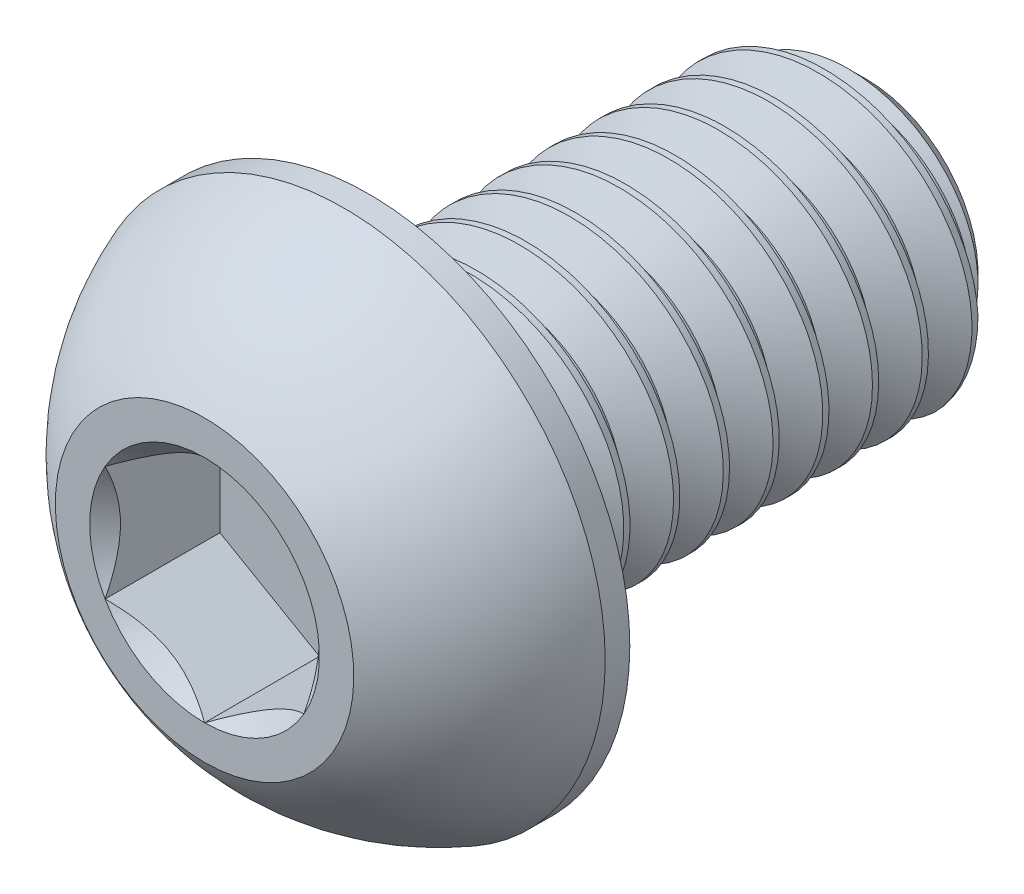
from build123d import *

# Parameters (mm, degrees)
SKETCH1_W              = 10
SKETCH1_H              = 3
CUT_EXTRUDE2_DEPTH     = 2.31
SPLIT1_SURFACE_1_BACK  = 20.935
SPLIT1_SURFACE_1_DEPTH = 41.87
SPLIT1_SURFACE_2_BACK  = 20.935
SPLIT1_SURFACE_2_DEPTH = 41.87
CHAMFER1_SIZE          = 0.75
CUT_SWEEP1_PITCH       = 1
CUT_SWEEP1_TO          = 10


with BuildPart() as part:
    # Sketch1 → Revolve1 (revolve)
    with BuildSketch(Plane(origin=(0, 0, 0), x_dir=(0, 0, -1), z_dir=(1, 0, 0))):
        with Locations((8.3, 1.5)):
            Rectangle(SKETCH1_W, SKETCH1_H)
    revolve(axis=Axis((0, 0, -13.3), (0, 0, 1)))

    # Sketch7 → Revolve2 (revolve)
    with BuildSketch(Plane(origin=(0, 0, 0), x_dir=(0, 0, -1), z_dir=(1, 0, 0)), mode=Mode.PRIVATE) as revolve2_sk:
        with BuildLine():
            Line((2.805, 5.25), (3.3, 5.25))
            Line((3.3, 5.25), (3.3, 0))
            Line((3.3, 0), (0, 0))
            Line((0, 0), (0, 3))
            ThreePointArc((0, 3), (1.216479019, 4.356906156), (2.805, 5.25))
        make_face()
    revolve(revolve2_sk.sketch.rotate(Axis((0, 0, 0), (0, 0, -1)), 180), axis=Axis((0, 0, 0), (0, 0, -1)))

    # Sketch5 → Cut-Extrude2 (cut)
    with BuildSketch(Plane.XY):
        Polygon((2, -1.154700538), (2, 1.154700538), (0, 2.309401077), (-2, 1.154700538), (-2, -1.154700538), (0, -2.309401077), align=None)
    extrude(amount=-CUT_EXTRUDE2_DEPTH, mode=Mode.SUBTRACT)

    # Cut-Extrude3 cone 1 section (through the dimple's axis) → Cut-Extrude3 (revolve, cut)
    with BuildSketch(Plane(origin=(0, 0, 0), x_dir=(0, -1, 0), z_dir=(1, 0, 0))):
        Polygon((0, 0), (2.309401077, 0), (0, 2.309401077), align=None)
    revolve(axis=Axis((0, 0, 0), (0, 0, -1)), mode=Mode.SUBTRACT)


with BuildPart() as body_2:
    # Split1: the piece behind the surface
    add(part.part)
    # Split1 surface: a surface, the sketch's curves swept straight by 41.87 mm
    with BuildLine(Plane(origin=(0, 0, 0), x_dir=(0, 0, -1), z_dir=(1, 0, 0)).offset(-SPLIT1_SURFACE_1_BACK), mode=Mode.PRIVATE) as split1_surface_1_path:
        Line((3.3, -5.25), (3.3, 5.25))
    split1_surface_1 = Shell.extrude(split1_surface_1_path.wire(), (1 * SPLIT1_SURFACE_1_DEPTH, 0 * SPLIT1_SURFACE_1_DEPTH, 0 * SPLIT1_SURFACE_1_DEPTH))
    split(bisect_by=split1_surface_1, keep=Keep.BOTTOM)

    # Chamfer1
    chamfer1_edges = [body_2.edges().sort_by_distance(p)[0] for p in [
        (0, -3, -13.3),
    ]]
    chamfer(chamfer1_edges, length=CHAMFER1_SIZE)

    # Cut-Sweep1: arcs per turn and ends read off the stored shape
    # Cut-Sweep1: the profile of Sketch2 screwed along a right-hand helix through 11 turns, 8 arcs to a turn; built about Z, then put on its axis
    cut_sweep1_z = Axis((0, 0, 0), (0, 0, 1))
    cut_sweep1_corners = [(2.350480947, 0, -0.375), (2.350480947, 0, -0.5), (3.054126588, 0, -0.90625), (3.054126588, 0, 0.03125)]
    with BuildLine(mode=Mode.PRIVATE) as cut_sweep1_profile:
        Line(cut_sweep1_corners[0], cut_sweep1_corners[1])
        Line(cut_sweep1_corners[1], cut_sweep1_corners[2])
        Line(cut_sweep1_corners[2], cut_sweep1_corners[3])
        Line(cut_sweep1_corners[3], cut_sweep1_corners[0])
    cut_sweep1_cap = Face(cut_sweep1_profile.wire())
    cut_sweep1_turn_angles = [0, 22.5, 45, 67.5, 90, 112.5, 135, 157.5, 180, 202.5, 225, 247.5, 270, 292.5, 315, 337.5, 360]
    cut_sweep1_turn_weights = [1, 0.9238795325112867, 1, 0.9238795325112867, 1, 0.9238795325112867, 1, 0.9238795325112867, 1, 0.9238795325112867, 1, 0.9238795325112867, 1, 0.9238795325112867, 1, 0.9238795325112867, 1]
    cut_sweep1_turn_rails = [Edge.make_bspline([Vector(p[0], p[1], 0).rotate(cut_sweep1_z, cut_sweep1_turn_angles[k]) / cut_sweep1_turn_weights[k] + Vector(0, 0, p[2] + CUT_SWEEP1_PITCH * cut_sweep1_turn_angles[k] / 360) for k in range(17)], [0, 0, 0, 1, 1, 2, 2, 3, 3, 4, 4, 5, 5, 6, 6, 7, 7, 8, 8, 8], 2, cut_sweep1_turn_weights) for p in cut_sweep1_corners]
    cut_sweep1_turn_sides = [Face.make_surface_from_curves(cut_sweep1_turn_rails[p[0]], cut_sweep1_turn_rails[p[1]]) for p in [(0, 1), (1, 2), (2, 3), (3, 0)]]
    cut_sweep1 = Plane(origin=(0, 0, -13.3), x_dir=(0, 1, 0), z_dir=(0, 0, 1)) * split(Solid(Shell([*[p.moved(Location((0, 0, CUT_SWEEP1_PITCH * i))) for i in range(11) for p in cut_sweep1_turn_sides], cut_sweep1_cap, cut_sweep1_cap.rotate(cut_sweep1_z, 3960).moved(Location((0, 0, CUT_SWEEP1_PITCH * 3960 / 360)))])), bisect_by=Plane.XY.offset(CUT_SWEEP1_TO), keep=Keep.BOTTOM, mode=Mode.PRIVATE)
    add(cut_sweep1, mode=Mode.SUBTRACT)


with BuildPart() as part_1:
    add(part.part)

    # Split1: split by a surface, the side it looks to stays
    # Split1 surface: a surface, the sketch's curves swept straight by 41.87 mm
    with BuildLine(Plane(origin=(0, 0, 0), x_dir=(0, 0, -1), z_dir=(1, 0, 0)).offset(-SPLIT1_SURFACE_2_BACK), mode=Mode.PRIVATE) as split1_surface_2_path:
        Line((3.3, -5.25), (3.3, 5.25))
    split1_surface_2 = Shell.extrude(split1_surface_2_path.wire(), (1 * SPLIT1_SURFACE_2_DEPTH, 0 * SPLIT1_SURFACE_2_DEPTH, 0 * SPLIT1_SURFACE_2_DEPTH))
    split(bisect_by=split1_surface_2, keep=Keep.TOP)

    # Combine1: union body 2
    add(body_2.part)


solid = part_1.part
